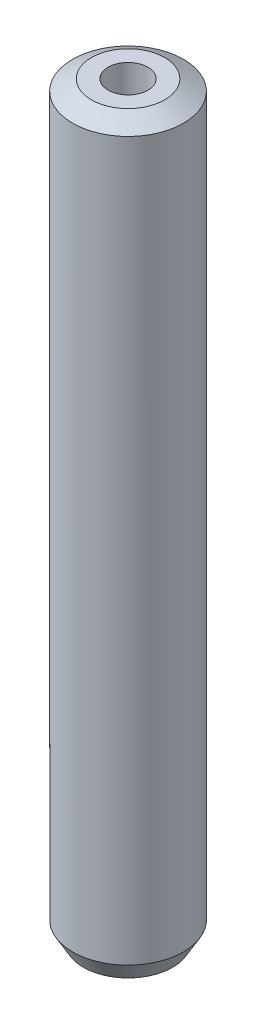
from build123d import *
from OCP.BRepFilletAPI import BRepFilletAPI_MakeChamfer

# Parameters (mm, degrees)
SKETCH1_R           = 17.5
BOSS_EXTRUDE1_DEPTH = 235.905462571
SKETCH2_R           = 6.287733418
CUT_EXTRUDE1_DEPTH  = 238.200099643
CHAMFER1_SIZE       = 3.424840901
CHAMFER1_SIZE2      = 5.931998449


with BuildPart() as part:
    # Sketch1 → Boss-Extrude1 (new body)
    with BuildSketch(Plane(origin=(0, 0, 0), x_dir=(1, 0, 0), z_dir=(0, 1, 0))):
        Circle(SKETCH1_R)
    extrude(amount=BOSS_EXTRUDE1_DEPTH)

    # Sketch2 → Cut-Extrude1 (cut, through all)
    with BuildSketch(Plane(origin=(0, 0, 0), x_dir=(1, 0, 0), z_dir=(0, 1, 0))):
        Circle(SKETCH2_R)
    extrude(amount=CUT_EXTRUDE1_DEPTH, mode=Mode.SUBTRACT)

    # Chamfer1: one chamfer whose edges measure the first distance from different faces: ONE call of the kernel's chamfer builder (chamfer() names one face for all edges)
    chamfer1_edges_1 = [part.edges().sort_by_distance(p)[0] for p in [
        (-17.5, 235.905462571, 0),
    ]]
    chamfer1_side_1 = [part.faces().sort_by_distance(p)[0] for p in [
        (-17.5, 117.952731285, 0),
    ]]
    chamfer1_edges_2 = [part.edges().sort_by_distance(p)[0] for p in [
        (-17.5, 0, 0),
    ]]
    chamfer1_side_2 = [part.faces().sort_by_distance(p)[0] for p in [
        (-17.005025253, 0, 0),
    ]]
    chamfer1 = BRepFilletAPI_MakeChamfer(part.part.solid().wrapped)
    for e in chamfer1_edges_1:
        chamfer1.Add(CHAMFER1_SIZE, CHAMFER1_SIZE2, e.wrapped, chamfer1_side_1[0].wrapped)  # the first distance lies on this face
    for e in chamfer1_edges_2:
        chamfer1.Add(CHAMFER1_SIZE, CHAMFER1_SIZE2, e.wrapped, chamfer1_side_2[0].wrapped)  # the first distance lies on this face
    add(Compound.cast(chamfer1.Shape()), mode=Mode.REPLACE)


solid = part.part
